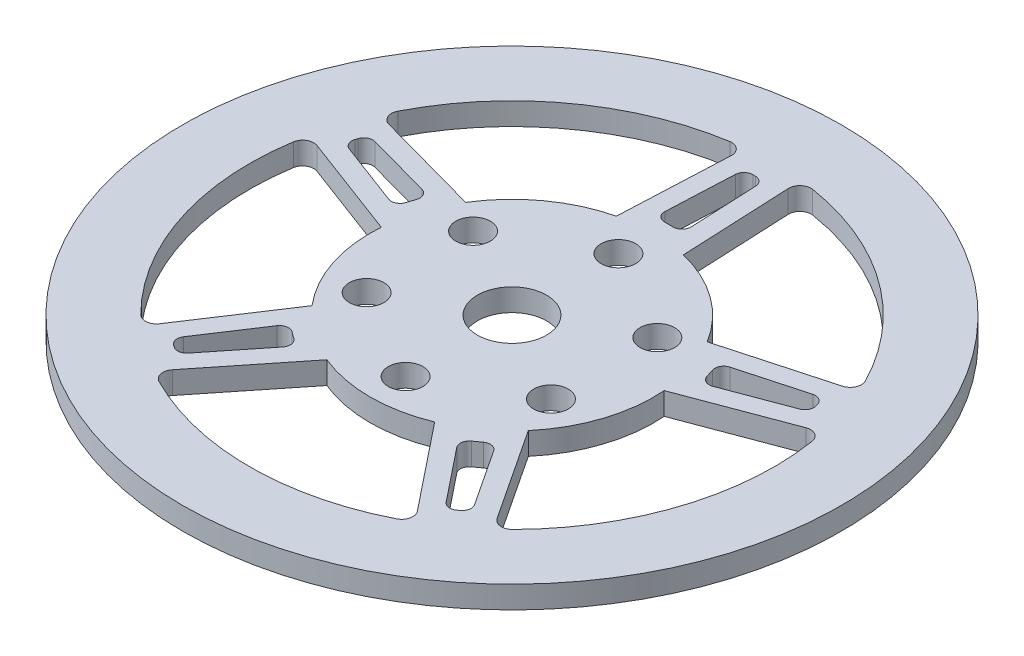
from build123d import *

# Parameters (mm, degrees)
SKETCH1_R           = 29.5
SKETCH1_R_2         = 1.55
SKETCH1_R_3         = 3.1
BOSS_EXTRUDE1_DEPTH = 2
FILLET2_R           = 1
FILLET3_R           = 0.8


with BuildPart() as part:
    # Sketch1 → Boss-Extrude1 (new body)
    with BuildSketch(Plane(origin=(0, 0, 0), x_dir=(1, 0, 0), z_dir=(0, 1, 0))):
        Circle(SKETCH1_R)
        with Locations((0, 9.525)):
            Circle(SKETCH1_R_2, mode=Mode.SUBTRACT)
        with Locations((-8.248891971, 4.7625)):
            Circle(SKETCH1_R_2, mode=Mode.SUBTRACT)
        with Locations((-8.248891971, -4.7625)):
            Circle(SKETCH1_R_2, mode=Mode.SUBTRACT)
        with Locations((0, -9.525)):
            Circle(SKETCH1_R_2, mode=Mode.SUBTRACT)
        with Locations((8.248891971, 4.7625)):
            Circle(SKETCH1_R_2, mode=Mode.SUBTRACT)
        Circle(SKETCH1_R_3, mode=Mode.SUBTRACT)
        with Locations((8.248891971, -4.7625)):
            Circle(SKETCH1_R_2, mode=Mode.SUBTRACT)
        with BuildLine():
            Line((-2.5, 23.366642891), (-3, 12.340583455))
            ThreePointArc((-3, 12.340583455), (-7.464872704, 10.274515829), (-10.809541326, 6.666619557))
            Line((-10.809541326, 6.666619557), (-21.4504555, 9.598331046))
            ThreePointArc((-21.4504555, 9.598331046), (-13.812953429, 19.011899368), (-2.5, 23.366642891))
        make_face(mode=Mode.SUBTRACT)
        with BuildLine():
            Line((2.5, 23.366642891), (3, 12.340583455))
            ThreePointArc((3, 12.340583455), (7.464872704, 10.274515829), (10.809541326, 6.666619557))
            Line((10.809541326, 6.666619557), (21.4504555, 9.598331046))
            ThreePointArc((21.4504555, 9.598331046), (13.812953429, 19.011899368), (2.5, 23.366642891))
        make_face(mode=Mode.SUBTRACT)
        Polygon((-0.875343089, 21.666642891), (0.875343089, 21.666642891), (1.221162893, 14.040583455), (-1.221162893, 14.040583455), align=None, mode=Mode.SUBTRACT)
        Polygon((12.9760283, 5.500173825), (20.335706018, 7.527861613), (20.876697798, 5.862860116), (13.730748474, 3.177383971), align=None, mode=Mode.SUBTRACT)
        with BuildLine():
            Line((22.995540471, 4.843048464), (12.663643293, 0.960280459))
            ThreePointArc((12.663643293, 0.960280459), (12.078417757, -3.924515829), (9.680663942, -8.220385978))
            Line((9.680663942, -8.220385978), (15.757110573, -17.43454807))
            ThreePointArc((15.757110573, -17.43454807), (22.349828133, -7.261899368), (22.995540471, 4.843048464))
        make_face(mode=Mode.SUBTRACT)
        Polygon((9.240789422, -10.641289087), (13.443500593, -17.014168552), (12.027165723, -18.043196068), (7.264906355, -12.076852165), align=None, mode=Mode.SUBTRACT)
        with BuildLine():
            Line((11.712025601, -20.373474331), (4.826561976, -11.747097492))
            ThreePointArc((4.826561976, -11.747097492), (0, -12.7), (-4.826561976, -11.747097492))
            Line((-4.826561976, -11.747097492), (-11.712025601, -20.373474331))
            ThreePointArc((-11.712025601, -20.373474331), (0, -23.5), (11.712025601, -20.373474331))
        make_face(mode=Mode.SUBTRACT)
        Polygon((-7.264906355, -12.076852165), (-12.027165723, -18.043196068), (-13.443500593, -17.014168552), (-9.240789422, -10.641289087), align=None, mode=Mode.SUBTRACT)
        with BuildLine():
            Line((-15.757110573, -17.43454807), (-9.680663942, -8.220385978))
            ThreePointArc((-9.680663942, -8.220385978), (-12.078417757, -3.924515829), (-12.663643293, 0.960280459))
            Line((-12.663643293, 0.960280459), (-22.995540471, 4.843048464))
            ThreePointArc((-22.995540471, 4.843048464), (-22.349828133, -7.261899368), (-15.757110573, -17.43454807))
        make_face(mode=Mode.SUBTRACT)
        Polygon((-13.730748474, 3.177383971), (-20.876697798, 5.862860116), (-20.335706018, 7.527861613), (-12.9760283, 5.500173825), align=None, mode=Mode.SUBTRACT)
    extrude(amount=BOSS_EXTRUDE1_DEPTH)

    # Fillet2
    fillet2_edges = [part.edges().sort_by_distance(p)[0] for p in [
        (-15.757110573, 1, 17.43454807),
        (-11.712025601, 1, 20.373474331),
        (11.712025601, 1, 20.373474331),
        (15.757110573, 1, 17.43454807),
        (22.995540471, 1, -4.843048464),
        (21.4504555, 1, -9.598331046),
        (2.5, 1, -23.366642891),
        (-2.5, 1, -23.366642891),
        (-22.995540471, 1, -4.843048464),
        (-21.4504555, 1, -9.598331046),
    ]]
    fillet(fillet2_edges, radius=FILLET2_R)

    # Fillet3
    fillet3_edges = [part.edges().sort_by_distance(p)[0] for p in [
        (-20.876697798, 1, -5.862860116),
        (-20.335706018, 1, -7.527861613),
        (-12.9760283, 1, -5.500173825),
        (-13.730748474, 1, -3.177383971),
        (-12.027165723, 1, 18.043196068),
        (-13.443500593, 1, 17.014168552),
        (-9.240789422, 1, 10.641289087),
        (-7.264906355, 1, 12.076852165),
        (13.443500593, 1, 17.014168552),
        (12.027165723, 1, 18.043196068),
        (7.264906355, 1, 12.076852165),
        (9.240789422, 1, 10.641289087),
        (12.9760283, 1, -5.500173825),
        (20.335706018, 1, -7.527861613),
        (20.876697798, 1, -5.862860116),
        (13.730748474, 1, -3.177383971),
        (-0.875343089, 1, -21.666642891),
        (0.875343089, 1, -21.666642891),
        (-1.221162893, 1, -14.040583455),
        (1.221162893, 1, -14.040583455),
    ]]
    fillet(fillet3_edges, radius=FILLET3_R)


solid = part.part
